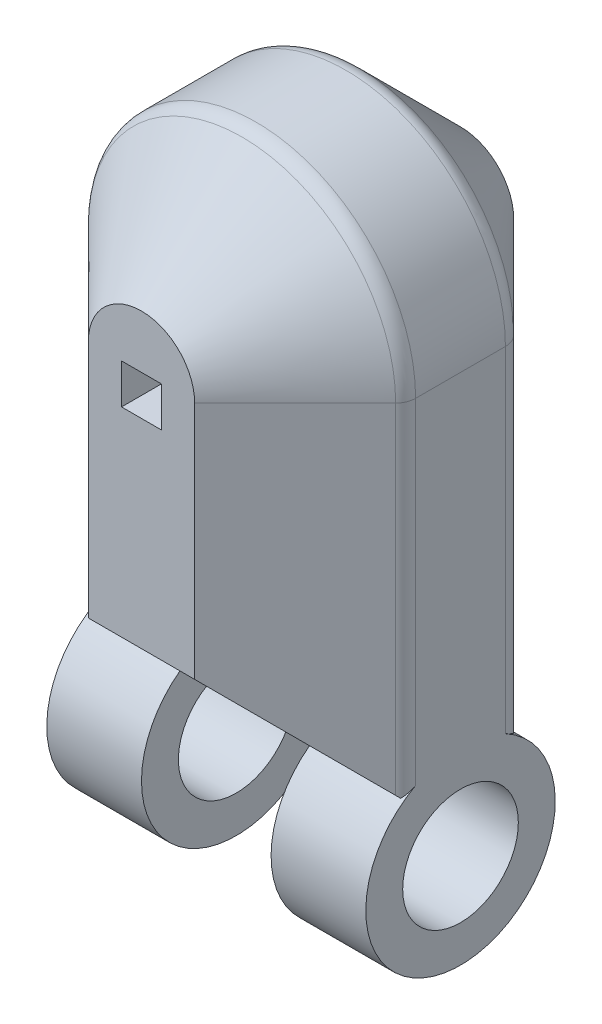
from build123d import *

# Parameters (mm, degrees)
BOSS_EXTRUDE1_DEPTH     = 10
CUT_EXTRUDE1_DEPTH      = 12.489125293
CUT_EXTRUDE1_DEPTH_BACK = 12.489125293
CUT_EXTRUDE2_DEPTH      = 10
SKETCH6_R               = 2.625
CUT_EXTRUDE4_DEPTH      = 1.625
BOSS_EXTRUDE3_REACH     = 14.151
SKETCH7_R               = 2.375
BOSS_EXTRUDE4_START     = -2.375
SKETCH8_R               = 2.375
BOSS_EXTRUDE4_DEPTH     = 2.375
CUT_EXTRUDE6_DEPTH      = 14.416407865
CUT_EXTRUDE6_DEPTH_BACK = 14.416407865
SKETCH11_R              = 1.45
REVOLVE1_ANGLE          = 180
FILLET1_R               = 0.5
FILLET2_R               = 0.5
SKETCH13_W              = 1
SKETCH13_H              = 1
CUT_EXTRUDE7_DEPTH      = 16.7480159
SKETCH14_W              = 1
SKETCH14_H              = 1
CUT_EXTRUDE8_DEPTH      = 17.155494533


with BuildPart() as part:
    # Sketch1 → Boss-Extrude1 (new body)
    with BuildSketch(Plane(origin=(0, 0, 0), x_dir=(1, 0, 0), z_dir=(0, 1, 0))):
        Polygon((-1.333333333, -4), (1.333333333, -4), (4, -1.333333333), (4, 1.333333333), (1.333333333, 4), (-1.333333333, 4), (-4, 1.333333333), (-4, -1.333333333), align=None)
    extrude(amount=BOSS_EXTRUDE1_DEPTH)

    # Sketch2 → Cut-Extrude1 (cut, two sides: drawn at the far end of the back side and taken through both)
    with BuildSketch(Plane(origin=(0, 0, 0), x_dir=(0, 0, -1), z_dir=(1, 0, 0)).offset(-CUT_EXTRUDE1_DEPTH_BACK)):
        Polygon((0, 0), (-4, 0), (-4, 4), align=None)
    extrude(amount=CUT_EXTRUDE1_DEPTH + CUT_EXTRUDE1_DEPTH_BACK, mode=Mode.SUBTRACT)

    # Sketch3 → Cut-Extrude2 (cut)
    with BuildSketch(Plane(origin=(0, 0, 0), x_dir=(1, 0, 0), z_dir=(0, 1, 0))):
        Polygon((0, -3), (-0.5, -2.5), (-0.5, -2), (0.5, -2), (0.5, -2.5), align=None)
        Polygon((0.5, 3), (0.5, 2.5), (0, 2), (-0.5, 2.5), (-0.5, 3), align=None)
    extrude(amount=CUT_EXTRUDE2_DEPTH, mode=Mode.SUBTRACT)

    # Sketch6 → Cut-Extrude4 (cut, symmetric)
    with BuildSketch(Plane(origin=(0, 0, 0), x_dir=(0, 0, -1), z_dir=(1, 0, 0))):
        with Locations((0, -0.5)):
            Circle(SKETCH6_R)
    extrude(amount=CUT_EXTRUDE4_DEPTH, both=True, mode=Mode.SUBTRACT)

    # Boss-Extrude3: up to this face of the body (flat: up to its plane)
    boss_extrude3_end = Plane(part.part.faces().sort_by_distance((-4, 5.157088123, -0.030651341))[0])
    # Sketch7 → Boss-Extrude3 (add, up to the picked face)
    with BuildSketch(Plane(origin=(-1.625, 0, 0), x_dir=(0, 0, -1), z_dir=(1, 0, 0)), mode=Mode.PRIVATE) as boss_extrude3_sk1:
        with Locations((0, -0.5)):
            Circle(SKETCH7_R)
    boss_extrude3_tool1 = split(extrude(boss_extrude3_sk1.sketch, amount=-BOSS_EXTRUDE3_REACH, mode=Mode.PRIVATE), bisect_by=boss_extrude3_end, keep=Keep.BOTH, mode=Mode.PRIVATE)
    add(boss_extrude3_tool1.solids().sort_by(Axis((-1.625, -0.5, 0), (-1, 0, 0)))[0])

    # Sketch8 → Boss-Extrude4 (add)
    with BuildSketch(Plane.ZY.offset(-1.625).offset(BOSS_EXTRUDE4_START)):
        with Locations((0, -0.5)):
            Circle(SKETCH8_R)
    extrude(amount=BOSS_EXTRUDE4_DEPTH)

    # Sketch11 → Cut-Extrude6 (cut, two sides: drawn at the far end of the back side and taken through both)
    with BuildSketch(Plane(origin=(4, 0, 0), x_dir=(0, 0, -1), z_dir=(1, 0, 0)).offset(-CUT_EXTRUDE6_DEPTH_BACK)):
        with Locations((0, -0.5)):
            Circle(SKETCH11_R)
    extrude(amount=CUT_EXTRUDE6_DEPTH + CUT_EXTRUDE6_DEPTH_BACK, mode=Mode.SUBTRACT)

    # Sketch12 → Revolve1 (revolve)
    with BuildSketch(Plane(origin=(0, 10, 0), x_dir=(1, 0, 0), z_dir=(0, 1, 0))):
        Polygon((0, 4), (-1.333333333, 4), (-4, 1.333333333), (-4, -1.333333333), (-1.333333333, -4), (0, -4), align=None)
    revolve(axis=Axis((0, 10, 4), (0, 0, -1)), revolution_arc=REVOLVE1_ANGLE)

    # Fillet1
    # the kernel refuses this fillet: 0.5 mm, written as the material it takes off along each edge
    with BuildSketch(Plane(origin=(4, 0.947645783, 1.333333333), x_dir=(-0.7071067811865454, 0, 0.7071067811865497), z_dir=(0, 1, 0))) as fillet1_piece_1_section:
        with BuildLine():
            CenterArc((FILLET1_R * 0.414213562373, -FILLET1_R), FILLET1_R, 90, 45)
            Line((-FILLET1_R * 0.292893218813, -FILLET1_R * 0.292893218813), (0, 0))
            Line((0, 0), (FILLET1_R * 0.414213562373, 0))
        make_face()
    fillet1_piece_1 = extrude(amount=9.052354217, mode=Mode.PRIVATE)
    fillet1_piece_1 = fillet1_piece_1 - Plane(origin=(3.968890647, -0.5, 0), x_dir=(0, 0, 1), z_dir=(1, 0, 0)) * Cylinder(2.375, 19, mode=Mode.PRIVATE)
    add(fillet1_piece_1, mode=Mode.SUBTRACT)
    with BuildSketch(Plane(origin=(-4, 0.947645783, 1.333333333), x_dir=(0, 0, -1), z_dir=(0, 1, 0))) as fillet1_piece_2_section:
        with BuildLine():
            CenterArc((FILLET1_R * 0.414213562373, -FILLET1_R), FILLET1_R, 90, 45)
            Line((-FILLET1_R * 0.292893218813, -FILLET1_R * 0.292893218813), (0, 0))
            Line((0, 0), (FILLET1_R * 0.414213562373, 0))
        make_face()
    fillet1_piece_2 = extrude(amount=9.052354217, mode=Mode.PRIVATE)
    fillet1_piece_2 = fillet1_piece_2 - Plane(origin=(-3.968890645, -0.5, 0), x_dir=(0, 0, -1), z_dir=(1, 0, 0)) * Cylinder(2.375, 19, mode=Mode.PRIVATE)
    add(fillet1_piece_2, mode=Mode.SUBTRACT)
    with BuildSketch(Plane(origin=(0, 10, 1.333333333), x_dir=(-1, 0, 0), z_dir=(0, -1, 0))) as fillet1_piece_3:
        with BuildLine():
            CenterArc((4 - FILLET1_R, FILLET1_R * 0.414213562373), FILLET1_R, 315, 45)
            Line((4 - FILLET1_R * 0.292893218813, -FILLET1_R * 0.292893218813), (4, 0))
            Line((4, 0), (4, FILLET1_R * 0.414213562373))
        make_face()
    revolve(axis=Axis((0, 10, 1.333333333), (0, 0, -1)), revolution_arc=180, mode=Mode.SUBTRACT)

    # Fillet2
    fillet2_edges = [part.edges().sort_by_distance(p)[0] for p in [
        (4, 5.732706368, -1.333333333),
        (-4, 5.732706368, -1.333333333),
        (0, 14, -1.333333333),
    ]]
    fillet(fillet2_edges, radius=FILLET2_R)

    # Sketch13 → Cut-Extrude7 (cut, through all)
    with BuildSketch(Plane.XY.offset(2)):
        with Locations((0, 9.5)):
            Rectangle(SKETCH13_W, SKETCH13_H)
    extrude(amount=CUT_EXTRUDE7_DEPTH, mode=Mode.SUBTRACT)

    # Sketch14 → Cut-Extrude8 (cut, through all)
    with BuildSketch(Plane.XY.offset(-3)):
        with Locations((0, 9.5)):
            Rectangle(SKETCH14_W, SKETCH14_H)
    extrude(amount=-CUT_EXTRUDE8_DEPTH, mode=Mode.SUBTRACT)


solid = part.part
